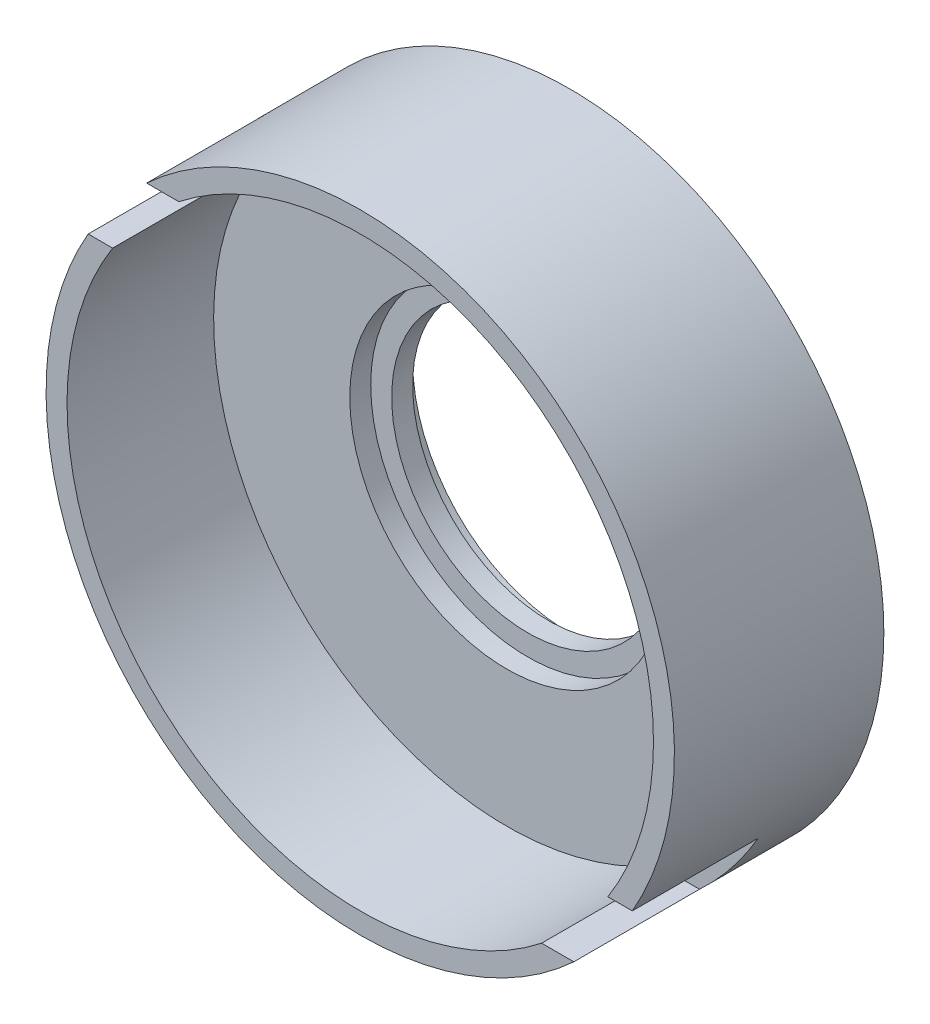
from build123d import *

# Parameters (mm, degrees)
SKETCH_5_R          = 30
EXTRUDE_1_DEPTH     = 20
CUT_EXTRUDE_START   = 6
SKETCH_6_R          = 28
CUT_EXTRUDE_1_DEPTH = 14
SKETCH_7_R          = 13
CUT_EXTRUDE_2_DEPTH = 15
CUT_EXTRUDE_START_2 = 4
SKETCH_8_R          = 15
CUT_EXTRUDE_3_DEPTH = 16
CUT_EXTRUDE_START_3 = 8
SKETCH_10_W         = 15
SKETCH_10_H         = 7
CUT_EXTRUDE_4_DEPTH = 12
SKETCH_13_W         = 15
SKETCH_13_H         = 7
CUT_EXTRUDE_5_DEPTH = 12
SKETCH_14_R         = 15
CUT_EXTRUDE_6_DEPTH = 2


with BuildPart() as part:
    # Эскиз5 → Бобышка-Вытянуть1 (new body)
    with BuildSketch(Plane.XY):
        Circle(SKETCH_5_R)
    extrude(amount=EXTRUDE_1_DEPTH)

    # Эскиз6 → Вырез-Вытянуть1 (cut)
    with BuildSketch(Plane.XY.offset(CUT_EXTRUDE_START)):
        Circle(SKETCH_6_R)
    extrude(amount=CUT_EXTRUDE_1_DEPTH, mode=Mode.SUBTRACT)

    # Эскиз7 → Вырез-Вытянуть2 (cut)
    with BuildSketch(Plane.XY):
        Circle(SKETCH_7_R)
    extrude(amount=CUT_EXTRUDE_2_DEPTH, mode=Mode.SUBTRACT)

    # Эскиз8 → Вырез-Вытянуть3 (cut)
    with BuildSketch(Plane.XY.offset(CUT_EXTRUDE_START_2)):
        Circle(SKETCH_8_R)
    extrude(amount=CUT_EXTRUDE_3_DEPTH, mode=Mode.SUBTRACT)

    # Эскиз10 → Вырез-Вытянуть4 (cut)
    with BuildSketch(Plane.XY.offset(CUT_EXTRUDE_START_3)):
        with Locations((-22.5, 18.5)):
            Rectangle(SKETCH_10_W, SKETCH_10_H)
    extrude(amount=CUT_EXTRUDE_4_DEPTH, mode=Mode.SUBTRACT)

    # Эскиз13 → Вырез-Вытянуть5 (cut)
    with BuildSketch(Plane.XY.offset(CUT_EXTRUDE_START_3)):
        with Locations((22.5, -18.5)):
            Rectangle(SKETCH_13_W, SKETCH_13_H)
    extrude(amount=CUT_EXTRUDE_5_DEPTH, mode=Mode.SUBTRACT)

    # Эскиз14 → Вырез-Вытянуть6 (cut)
    with BuildSketch(Plane.XY):
        Circle(SKETCH_14_R)
    extrude(amount=CUT_EXTRUDE_6_DEPTH, mode=Mode.SUBTRACT)


solid = part.part
